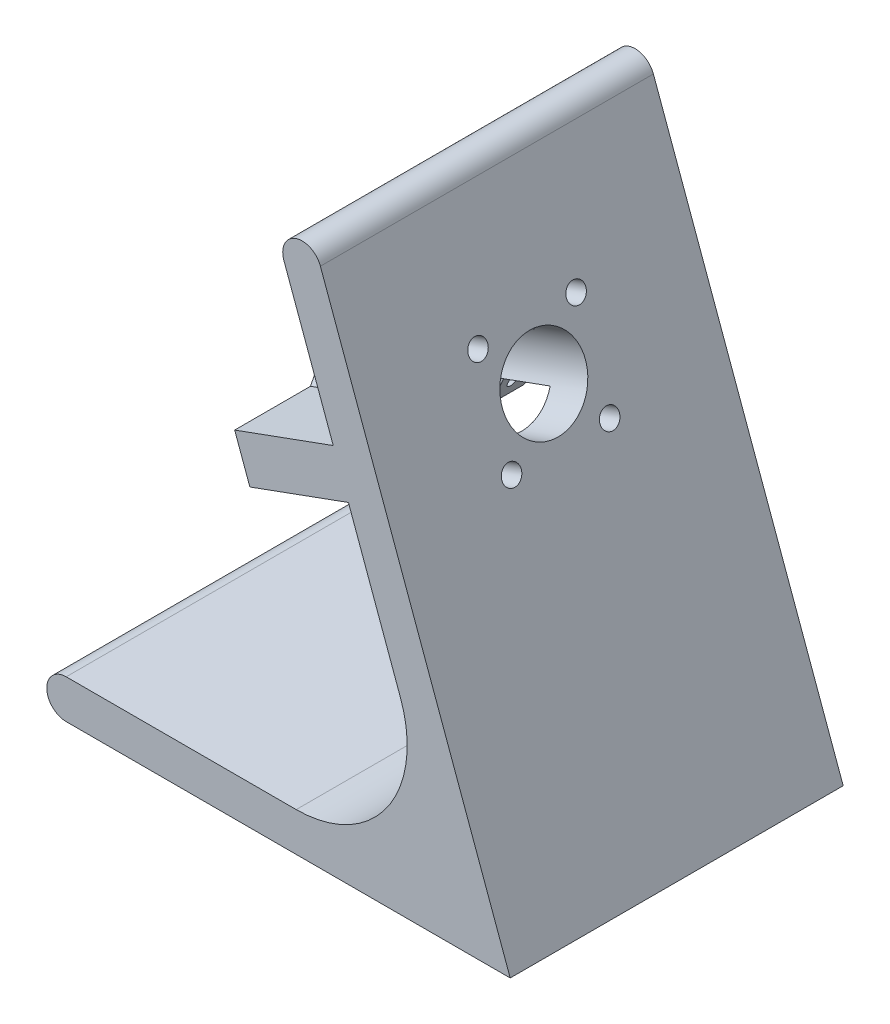
from build123d import *
from build123d.topology import SkipClean

# Parameters (mm, degrees)
BOSS_EXTRUDE1_DEPTH = 60
SKETCH2_R           = 7.5
CUT_EXTRUDE1_DEPTH  = 119.641534805
SKETCH3_R           = 1.75
CUT_EXTRUDE2_DEPTH  = 117.134798875
CHAMFER1_SIZE       = 2
CHAMFER1_SIZE2      = 1.154700538
BOSS_EXTRUDE2_DEPTH = 18.9
SKETCH5_W           = 5
SKETCH5_H           = 4
SKETCH5_R           = 1
BOSS_EXTRUDE3_DEPTH = 5
CHAMFER2_SIZE       = 5


with BuildPart() as part:
    # Sketch1 → Boss-Extrude1 (new body)
    with BuildSketch(Plane.XY):
        with BuildLine():
            Line((0, 0), (80, 0))
            Line((80, 0), (45.797985667, 93.969262079))
            ThreePointArc((45.797985667, 93.969262079), (41.311990993, 96.06111575), (39.220137322, 91.575121075))
            Line((39.220137322, 91.575121075), (60.233856234, 33.840402867))
            ThreePointArc((60.233856234, 33.840402867), (57.823044704, 15.528471273), (41.440003818, 7))
            Line((41.440003818, 7), (0, 7))
            ThreePointArc((0, 7), (-3.5, 3.5), (0, 0))
        make_face()
    extrude(amount=BOSS_EXTRUDE1_DEPTH)

    # Sketch2 → Cut-Extrude1 (cut, through all)
    with BuildSketch(Plane(origin=(70.641777725, 25.711504387, 0), x_dir=(0, 0, -1), z_dir=(0.9396926207859069, 0.3420201433256728, 0))):
        with Locations(Location((-30, 42.638388534, 0), (0, 0, 90))):
            Circle(SKETCH2_R)
    extrude(amount=-CUT_EXTRUDE1_DEPTH, mode=Mode.SUBTRACT)

    # Sketch3 → Cut-Extrude2 (cut, through all)
    with BuildSketch(Plane(origin=(64.063929379, 23.317363384, 0), x_dir=(0, 0, 1), z_dir=(-0.9396926207859071, -0.3420201433256726, 0))):
        with Locations(Location((21.161165235, 33.799553769, 0), (0, 0, 270))):
            Circle(SKETCH3_R)
        with Locations(Location((21.161165235, 51.477223299, 0), (0, 0, 270))):
            Circle(SKETCH3_R)
        with Locations(Location((38.838834765, 51.477223299, 0), (0, 0, 270))):
            Circle(SKETCH3_R)
        with Locations(Location((38.838834765, 33.799553769, 0), (0, 0, 270))):
            Circle(SKETCH3_R)
    extrude(amount=-CUT_EXTRUDE2_DEPTH, mode=Mode.SUBTRACT)

    # Chamfer1
    chamfer1_edges = [part.edges().sort_by_distance(p)[0] for p in [
        (45.859146838, 73.334592343, 21.161165235),
        (45.859146838, 73.334592343, 38.838834765),
        (51.905265904, 56.723016733, 38.838834765),
        (51.905265904, 56.723016733, 21.161165235),
    ]]
    chamfer1_side = [part.faces().sort_by_distance(p)[0] for p in [
        (39.513854258, 90.768140426, 30),
    ]]
    chamfer(chamfer1_edges, length=CHAMFER1_SIZE, length2=CHAMFER1_SIZE2, reference=chamfer1_side[0])

    # Sketch4 → Boss-Extrude2 (add)
    with SkipClean():  # the faces are left unmerged after this step: merging them gives an invalid solid
        with BuildSketch(Plane(origin=(64.063929379, 23.317363384, 0), x_dir=(0, 0, 1), z_dir=(-0.9396926207859071, -0.3420201433256726, 0))):
            with BuildLine():
                Line((36.34428877, 46.638388534), (60, 46.638388534))
                Line((60, 46.638388534), (60, 38.638388534))
                Line((60, 38.638388534), (36.34428877, 38.638388534))
                ThreePointArc((36.34428877, 38.638388534), (37.5, 42.638388534), (36.34428877, 46.638388534))
            make_face()
            with BuildLine():
                Line((0, 38.638388534), (23.65571123, 38.638388534))
                ThreePointArc((23.65571123, 38.638388534), (22.5, 42.638388534), (23.65571123, 46.638388534))
                Line((23.65571123, 46.638388534), (0, 46.638388534))
                Line((0, 46.638388534), (0, 38.638388534))
            make_face()
        extrude(amount=BOSS_EXTRUDE2_DEPTH)

    # Sketch5 → Boss-Extrude3 (add)
    # profile 1 of 4: a face of its own
    with SkipClean():  # the faces are left unmerged after this step: merging them gives an invalid solid
        with BuildSketch(Plane(origin=(46.303738846, 16.853182675, 0), x_dir=(0, 0, 1), z_dir=(-0.9396926207859069, -0.3420201433256728, 0))):
            with Locations((21.15571123, 48.638388534)):
                Rectangle(SKETCH5_W, SKETCH5_H)
            with Locations(Location((21, 48.138388534, 0), (0, 0, 270))):
                Circle(SKETCH5_R, mode=Mode.SUBTRACT)
        # profile 2 of 4: a face of its own
        with BuildSketch(Plane(origin=(46.303738846, 16.853182675, 0), x_dir=(0, 0, 1), z_dir=(-0.9396926207859069, -0.3420201433256728, 0))):
            with Locations((38.84428877, 48.638388534)):
                Rectangle(SKETCH5_W, SKETCH5_H)
            with Locations(Location((39, 48.138388534, 0), (0, 0, 90))):
                Circle(SKETCH5_R, mode=Mode.SUBTRACT)
        # profile 3 of 4: a face of its own
        with BuildSketch(Plane(origin=(46.303738846, 16.853182675, 0), x_dir=(0, 0, 1), z_dir=(-0.9396926207859069, -0.3420201433256728, 0))):
            with Locations((38.84428877, 36.638388534)):
                Rectangle(SKETCH5_W, SKETCH5_H)
            with Locations(Location((39, 37.138388534, 0), (0, 0, 270))):
                Circle(SKETCH5_R, mode=Mode.SUBTRACT)
        # profile 4 of 4: a face of its own
        with BuildSketch(Plane(origin=(46.303738846, 16.853182675, 0), x_dir=(0, 0, 1), z_dir=(-0.9396926207859069, -0.3420201433256728, 0))):
            with Locations((21.15571123, 36.638388534)):
                Rectangle(SKETCH5_W, SKETCH5_H)
            with Locations(Location((21, 37.138388534, 0), (0, 0, 90))):
                Circle(SKETCH5_R, mode=Mode.SUBTRACT)
        extrude(amount=-BOSS_EXTRUDE3_DEPTH)

    # Chamfer2
    # the kernel refuses this chamfer: 5 mm, written as the material it adds along each edge
    with BuildSketch(Plane(origin=(37.787094766, 54.871491976, 23.48587383), x_dir=(0.9299331952381907, 0.3677285036464934, 0), z_dir=(0, 0, 1))) as chamfer2_piece_1_section:
        Polygon((CHAMFER2_SIZE * 0.999621916911, -CHAMFER2_SIZE * 0.0274958766106), (-CHAMFER2_SIZE * 0.0274958766106, -CHAMFER2_SIZE * 0.999621916911), (0, 0), align=None)
    chamfer2_piece_1 = extrude(amount=17.85841494, mode=Mode.PRIVATE)
    chamfer2_piece_1 = chamfer2_piece_1 - Plane(origin=(38.02216053, 59.213760007, 30), x_dir=(0.18241074310702424, -0.5011693977524806, -0.8459051693633035), z_dir=(0.9396926207859071, 0.34202014332567265, 0)) * Cylinder(7.5, 56, mode=Mode.PRIVATE)
    chamfer2_piece_1 = split(chamfer2_piece_1, bisect_by=Plane(origin=(39.909169975, 54.029244166, 23.65571123), z_dir=(0, 0, -1)), keep=Keep.TOP, mode=Mode.PRIVATE)
    chamfer2_piece_1 = split(chamfer2_piece_1, bisect_by=Plane(origin=(40.758321676, 51.696219041, 23.570135946), z_dir=(-0.3420201433256728, 0.9396926207859069, 0)), keep=Keep.TOP, mode=Mode.PRIVATE)
    add(chamfer2_piece_1)
    with BuildSketch(Plane(origin=(37.787094766, 54.871491976, 36.34428877), x_dir=(0.9299331952381793, 0.3677285036465222, 0), z_dir=(0, 0, 1))) as chamfer2_piece_2_section:
        Polygon((CHAMFER2_SIZE * 0.999621916911, -CHAMFER2_SIZE * 0.0274958766106), (-CHAMFER2_SIZE * 0.0274958766106, -CHAMFER2_SIZE * 0.999621916911), (0, 0), align=None)
    chamfer2_piece_2 = extrude(amount=5, mode=Mode.PRIVATE)
    chamfer2_piece_2 = chamfer2_piece_2 - Plane(origin=(40.576659633, 60.143521644, 30), x_dir=(0.18241074310702424, -0.5011693977524806, -0.8459051693633035), z_dir=(0.9396926207859071, 0.34202014332567265, 0)) * Cylinder(7.5, 30, mode=Mode.PRIVATE)
    chamfer2_piece_2 = split(chamfer2_piece_2, bisect_by=Plane(origin=(43.312820779, 52.625980678, 40.510955437), z_dir=(-0.3420201433256728, 0.9396926207859069, 0)), keep=Keep.TOP, mode=Mode.PRIVATE)
    chamfer2_piece_2 = chamfer2_piece_2 - Plane(origin=(42.457770421, 54.97521223, 39), x_dir=(0.3420201433256728, -0.9396926207859069, 0), z_dir=(-0.9396926207859069, -0.3420201433256728, 0)) * Cylinder(1, 30, mode=Mode.PRIVATE)
    add(chamfer2_piece_2)
    with BuildSketch(Plane(origin=(33.088631662, 53.16139126, 41.34428877), x_dir=(-0.00940414365922947, 0.02583767235303998, 0.9996219169112959), z_dir=(0.9396926207859069, 0.3420201433256728, 0))) as chamfer2_piece_3_section:
        Polygon((CHAMFER2_SIZE * 0.999621916911, CHAMFER2_SIZE * 0.0274958766106), (-CHAMFER2_SIZE * 0.0274958766106, CHAMFER2_SIZE * 0.999621916911), (0, 0), align=None)
    chamfer2_piece_3 = extrude(amount=5, mode=Mode.PRIVATE)
    chamfer2_piece_3 = split(chamfer2_piece_3, bisect_by=Plane(origin=(36.805943787, 50.257671135, 43.072880832), z_dir=(-0.3420201433256728, 0.9396926207859069, 1.4210854715202e-15)), keep=Keep.TOP, mode=Mode.PRIVATE)
    add(chamfer2_piece_3)
    with BuildSketch(Plane(origin=(37.787094766, 54.871491976, 36.51412617), x_dir=(0.9299331952381907, 0.3677285036464934, 0), z_dir=(0, 0, -1))) as chamfer2_piece_4_section:
        Polygon((CHAMFER2_SIZE * 0.999621916911, CHAMFER2_SIZE * 0.0274958766106), (-CHAMFER2_SIZE * 0.0274958766106, CHAMFER2_SIZE * 0.999621916911), (0, 0), align=None)
    chamfer2_piece_4 = extrude(amount=17.85841494, mode=Mode.PRIVATE)
    chamfer2_piece_4 = chamfer2_piece_4 - Plane(origin=(38.022160531, 59.213760008, 30), x_dir=(0.18241074310702424, -0.5011693977524806, -0.8459051693633035), z_dir=(0.9396926207859071, 0.34202014332567265, 0)) * Cylinder(7.5, 56, mode=Mode.PRIVATE)
    chamfer2_piece_4 = split(chamfer2_piece_4, bisect_by=Plane(origin=(39.909169977, 54.029244164, 36.34428877), z_dir=(0, 0, 1)), keep=Keep.TOP, mode=Mode.PRIVATE)
    chamfer2_piece_4 = split(chamfer2_piece_4, bisect_by=Plane(origin=(40.758321677, 51.696219041, 36.429864054), z_dir=(-0.3420201433256728, 0.9396926207859069, 0)), keep=Keep.TOP, mode=Mode.PRIVATE)
    add(chamfer2_piece_4)
    with BuildSketch(Plane(origin=(37.787094766, 54.871491976, 23.65571123), x_dir=(0.9299331952381796, 0.36772850364652154, 0), z_dir=(0, 0, -1))) as chamfer2_piece_5_section:
        Polygon((CHAMFER2_SIZE * 0.999621916911, CHAMFER2_SIZE * 0.0274958766106), (-CHAMFER2_SIZE * 0.0274958766106, CHAMFER2_SIZE * 0.999621916911), (0, 0), align=None)
    chamfer2_piece_5 = extrude(amount=5, mode=Mode.PRIVATE)
    chamfer2_piece_5 = chamfer2_piece_5 - Plane(origin=(40.576659674, 60.143521659, 30), x_dir=(0.18241074310702424, -0.5011693977524806, -0.8459051693633035), z_dir=(0.9396926207859071, 0.34202014332567265, 0)) * Cylinder(7.5, 30, mode=Mode.PRIVATE)
    chamfer2_piece_5 = split(chamfer2_piece_5, bisect_by=Plane(origin=(43.31282082, 52.625980693, 19.489044563), z_dir=(-0.3420201433256728, 0.9396926207859069, 0)), keep=Keep.TOP, mode=Mode.PRIVATE)
    chamfer2_piece_5 = chamfer2_piece_5 - Plane(origin=(42.457770462, 54.975212245, 21), x_dir=(-0.3420201433256728, 0.9396926207859069, 0), z_dir=(-0.9396926207859069, -0.3420201433256728, 0)) * Cylinder(1, 30, mode=Mode.PRIVATE)
    add(chamfer2_piece_5)
    with BuildSketch(Plane(origin=(33.088631662, 53.16139126, 18.65571123), x_dir=(-0.009404143659228424, 0.02583767235303711, -0.9996219169112959), z_dir=(0.9396926207859069, 0.3420201433256728, 0))) as chamfer2_piece_6_section:
        Polygon((CHAMFER2_SIZE * 0.999621916911, -CHAMFER2_SIZE * 0.0274958766106), (-CHAMFER2_SIZE * 0.0274958766106, -CHAMFER2_SIZE * 0.999621916911), (0, 0), align=None)
    chamfer2_piece_6 = extrude(amount=5, mode=Mode.PRIVATE)
    chamfer2_piece_6 = split(chamfer2_piece_6, bisect_by=Plane(origin=(36.805943787, 50.257671135, 16.927119168), z_dir=(-0.3420201433256728, 0.9396926207859069, 0)), keep=Keep.TOP, mode=Mode.PRIVATE)
    add(chamfer2_piece_6)
    with BuildSketch(Plane(origin=(30.352470516, 60.678932226, 18.65571123), x_dir=(0.009404143659218054, -0.025837672353008618, -0.9996219169112968), z_dir=(0.9396926207859069, 0.3420201433256728, 0))) as chamfer2_piece_7_section:
        Polygon((CHAMFER2_SIZE * 0.999621916911, CHAMFER2_SIZE * 0.0274958766106), (-CHAMFER2_SIZE * 0.0274958766106, CHAMFER2_SIZE * 0.999621916911), (0, 0), align=None)
    chamfer2_piece_7 = extrude(amount=5, mode=Mode.PRIVATE)
    chamfer2_piece_7 = split(chamfer2_piece_7, bisect_by=Plane(origin=(31.333621494, 65.292753067, 16.927119168), z_dir=(0.3420201433256728, -0.9396926207859069, 0)), keep=Keep.TOP, mode=Mode.PRIVATE)
    add(chamfer2_piece_7)
    with BuildSketch(Plane(origin=(35.050933619, 62.389032943, 36.51412617), x_dir=(0.9487414825566265, 0.3160531589404771, 0), z_dir=(0, 0, -1))) as chamfer2_piece_8_section:
        Polygon((CHAMFER2_SIZE * 0.999621916911, -CHAMFER2_SIZE * 0.0274958766106), (-CHAMFER2_SIZE * 0.0274958766106, -CHAMFER2_SIZE * 0.999621916911), (0, 0), align=None)
    chamfer2_piece_8 = extrude(amount=17.85841494, mode=Mode.PRIVATE)
    chamfer2_piece_8 = chamfer2_piece_8 - Plane(origin=(38.02216053, 59.213760007, 30), x_dir=(0.18241074310702424, -0.5011693977524806, -0.8459051693633035), z_dir=(0.9396926207859071, 0.34202014332567265, 0)) * Cylinder(7.5, 56, mode=Mode.PRIVATE)
    chamfer2_piece_8 = split(chamfer2_piece_8, bisect_by=Plane(origin=(35.285999383, 66.731300974, 36.429864054), z_dir=(0.3420201433256728, -0.9396926207859069, 0)), keep=Keep.TOP, mode=Mode.PRIVATE)
    chamfer2_piece_8 = split(chamfer2_piece_8, bisect_by=Plane(origin=(36.135151084, 64.398275849, 36.34428877), z_dir=(0, 0, 1)), keep=Keep.TOP, mode=Mode.PRIVATE)
    add(chamfer2_piece_8)
    with BuildSketch(Plane(origin=(35.050933619, 62.389032943, 23.65571123), x_dir=(0.9487414825566265, 0.3160531589404771, 0), z_dir=(0, 0, -1))) as chamfer2_piece_9_section:
        Polygon((CHAMFER2_SIZE * 0.999621916911, -CHAMFER2_SIZE * 0.0274958766106), (-CHAMFER2_SIZE * 0.0274958766106, -CHAMFER2_SIZE * 0.999621916911), (0, 0), align=None)
    chamfer2_piece_9 = extrude(amount=5, mode=Mode.PRIVATE)
    chamfer2_piece_9 = chamfer2_piece_9 - Plane(origin=(40.576659674, 60.143521659, 30), x_dir=(0.18241074310702424, -0.5011693977524806, -0.8459051693633035), z_dir=(0.9396926207859071, 0.34202014332567265, 0)) * Cylinder(7.5, 30, mode=Mode.PRIVATE)
    chamfer2_piece_9 = split(chamfer2_piece_9, bisect_by=Plane(origin=(37.840498527, 67.661062625, 19.489044563), z_dir=(0.3420201433256728, -0.9396926207859069, 0)), keep=Keep.TOP, mode=Mode.PRIVATE)
    chamfer2_piece_9 = chamfer2_piece_9 - Plane(origin=(38.695548885, 65.311831073, 21), x_dir=(0.3420201433256728, -0.9396926207859069, 0), z_dir=(-0.9396926207859069, -0.3420201433256728, 0)) * Cylinder(1, 30, mode=Mode.PRIVATE)
    add(chamfer2_piece_9)
    with BuildSketch(Plane(origin=(35.050933619, 62.389032943, 41.34428877), x_dir=(0.9487414825566282, 0.3160531589404717, 0), z_dir=(0, 0, -1))) as chamfer2_piece_10_section:
        Polygon((CHAMFER2_SIZE * 0.999621916911, -CHAMFER2_SIZE * 0.0274958766106), (-CHAMFER2_SIZE * 0.0274958766106, -CHAMFER2_SIZE * 0.999621916911), (0, 0), align=None)
    chamfer2_piece_10 = extrude(amount=5, mode=Mode.PRIVATE)
    chamfer2_piece_10 = chamfer2_piece_10 - Plane(origin=(40.576659633, 60.143521644, 30), x_dir=(0.18241074310702424, -0.5011693977524806, -0.8459051693633035), z_dir=(0.9396926207859071, 0.34202014332567265, 0)) * Cylinder(7.5, 30, mode=Mode.PRIVATE)
    chamfer2_piece_10 = split(chamfer2_piece_10, bisect_by=Plane(origin=(37.840498486, 67.661062611, 37.177622104), z_dir=(0.3420201433256728, -0.9396926207859069, 0)), keep=Keep.TOP, mode=Mode.PRIVATE)
    chamfer2_piece_10 = chamfer2_piece_10 - Plane(origin=(38.695548844, 65.311831059, 39), x_dir=(-0.3420201433256728, 0.9396926207859069, 0), z_dir=(-0.9396926207859069, -0.3420201433256728, 0)) * Cylinder(1, 30, mode=Mode.PRIVATE)
    add(chamfer2_piece_10)
    with BuildSketch(Plane(origin=(35.050933619, 62.389032943, 41.34428877), x_dir=(0.9487414825566282, 0.3160531589404717, 0), z_dir=(0, 0, -1))) as chamfer2_piece_11_section:
        Polygon((CHAMFER2_SIZE * 0.999621916911, -CHAMFER2_SIZE * 0.0274958766106), (-CHAMFER2_SIZE * 0.0274958766106, -CHAMFER2_SIZE * 0.999621916911), (0, 0), align=None)
    chamfer2_piece_11 = extrude(amount=17.85841494, mode=Mode.PRIVATE)
    chamfer2_piece_11 = chamfer2_piece_11 - Plane(origin=(38.022160531, 59.213760008, 30), x_dir=(0.18241074310702424, -0.5011693977524806, -0.8459051693633035), z_dir=(0.9396926207859071, 0.34202014332567265, 0)) * Cylinder(7.5, 56, mode=Mode.PRIVATE)
    chamfer2_piece_11 = split(chamfer2_piece_11, bisect_by=Plane(origin=(35.285999384, 66.731300974, 23.570135946), z_dir=(0.3420201433256728, -0.9396926207859069, 0)), keep=Keep.TOP, mode=Mode.PRIVATE)
    chamfer2_piece_11 = split(chamfer2_piece_11, bisect_by=Plane(origin=(36.135151085, 64.398275851, 23.65571123), z_dir=(0, 0, -1)), keep=Keep.TOP, mode=Mode.PRIVATE)
    add(chamfer2_piece_11)
    with BuildSketch(Plane(origin=(30.352470516, 60.678932226, 41.34428877), x_dir=(0.009404143659219547, -0.025837672353012715, 0.9996219169112965), z_dir=(0.9396926207859069, 0.3420201433256728, 0))) as chamfer2_piece_12_section:
        Polygon((CHAMFER2_SIZE * 0.999621916911, -CHAMFER2_SIZE * 0.0274958766106), (-CHAMFER2_SIZE * 0.0274958766106, -CHAMFER2_SIZE * 0.999621916911), (0, 0), align=None)
    chamfer2_piece_12 = extrude(amount=5, mode=Mode.PRIVATE)
    chamfer2_piece_12 = split(chamfer2_piece_12, bisect_by=Plane(origin=(31.333621494, 65.292753067, 43.072880832), z_dir=(0.3420201433256728, -0.9396926207859069, 1.4210854715202e-15)), keep=Keep.TOP, mode=Mode.PRIVATE)
    add(chamfer2_piece_12)
    with BuildSketch(Plane(origin=(37.787094766, 54.871491976, 36.34428877), x_dir=(0.9299331952381793, 0.3677285036465222, 0), z_dir=(0, 0, 1))) as chamfer2_piece_13a_section:
        Polygon((CHAMFER2_SIZE * 0.999621916911, -CHAMFER2_SIZE * 0.0274958766106), (-CHAMFER2_SIZE * 0.0274958766106, -CHAMFER2_SIZE * 0.999621916911), (0, 0), align=None)
    chamfer2_piece_13a = extrude(amount=17.85841494, mode=Mode.PRIVATE)
    chamfer2_piece_13a = split(chamfer2_piece_13a, bisect_by=Plane(origin=(40.779520544, 51.703934798, 47.77349624), z_dir=(-0.3420201433256728, 0.9396926207859069, 0)), keep=Keep.TOP, mode=Mode.PRIVATE)
    chamfer2_piece_13a = split(chamfer2_piece_13a, bisect_by=Plane(origin=(39.923484947, 54.05587327, 41.34428877), z_dir=(0, 0, 1)), keep=Keep.TOP, mode=Mode.PRIVATE)
    with BuildSketch(Plane(origin=(33.088631662, 53.16139126, 41.34428877), x_dir=(-0.00940414365922947, 0.02583767235303998, 0.9996219169112959), z_dir=(0.9396926207859069, 0.3420201433256728, 0))) as chamfer2_piece_13b_section:
        Polygon((CHAMFER2_SIZE * 0.999621916911, CHAMFER2_SIZE * 0.0274958766106), (-CHAMFER2_SIZE * 0.0274958766106, CHAMFER2_SIZE * 0.999621916911), (0, 0), align=None)
    chamfer2_piece_13b = extrude(amount=17.85841494, mode=Mode.PRIVATE)
    chamfer2_piece_13b = split(chamfer2_piece_13b, bisect_by=Plane(origin=(38.299139743, 53.464659965, 43.072880832), z_dir=(0.9396926207859069, 0.3420201433256728, 0)), keep=Keep.TOP, mode=Mode.PRIVATE)
    chamfer2_piece_13b = split(chamfer2_piece_13b, bisect_by=Plane(origin=(45.196654156, 53.311639954, 43.072880832), z_dir=(-0.3420201433256728, 0.9396926207859069, 1.4210854715202e-15)), keep=Keep.TOP, mode=Mode.PRIVATE)
    chamfer2_piece_13 = chamfer2_piece_13a & chamfer2_piece_13b
    add(chamfer2_piece_13)
    with BuildSketch(Plane(origin=(37.787094766, 54.871491976, 23.65571123), x_dir=(0.9299331952381796, 0.36772850364652154, 0), z_dir=(0, 0, -1))) as chamfer2_piece_14a_section:
        Polygon((CHAMFER2_SIZE * 0.999621916911, CHAMFER2_SIZE * 0.0274958766106), (-CHAMFER2_SIZE * 0.0274958766106, CHAMFER2_SIZE * 0.999621916911), (0, 0), align=None)
    chamfer2_piece_14a = extrude(amount=17.85841494, mode=Mode.PRIVATE)
    chamfer2_piece_14a = split(chamfer2_piece_14a, bisect_by=Plane(origin=(39.923484947, 54.05587327, 18.65571123), z_dir=(0, 0, -1)), keep=Keep.TOP, mode=Mode.PRIVATE)
    chamfer2_piece_14a = split(chamfer2_piece_14a, bisect_by=Plane(origin=(40.779520544, 51.703934798, 12.22650376), z_dir=(-0.3420201433256728, 0.9396926207859069, 0)), keep=Keep.TOP, mode=Mode.PRIVATE)
    with BuildSketch(Plane(origin=(33.088631662, 53.16139126, 18.65571123), x_dir=(-0.009404143659228424, 0.02583767235303711, -0.9996219169112959), z_dir=(0.9396926207859069, 0.3420201433256728, 0))) as chamfer2_piece_14b_section:
        Polygon((CHAMFER2_SIZE * 0.999621916911, -CHAMFER2_SIZE * 0.0274958766106), (-CHAMFER2_SIZE * 0.0274958766106, -CHAMFER2_SIZE * 0.999621916911), (0, 0), align=None)
    chamfer2_piece_14b = extrude(amount=17.85841494, mode=Mode.PRIVATE)
    chamfer2_piece_14b = split(chamfer2_piece_14b, bisect_by=Plane(origin=(38.299139743, 53.464659965, 16.927119168), z_dir=(0.9396926207859069, 0.3420201433256728, 0)), keep=Keep.TOP, mode=Mode.PRIVATE)
    chamfer2_piece_14b = split(chamfer2_piece_14b, bisect_by=Plane(origin=(45.196654156, 53.311639954, 16.927119168), z_dir=(-0.3420201433256728, 0.9396926207859069, 0)), keep=Keep.TOP, mode=Mode.PRIVATE)
    chamfer2_piece_14 = chamfer2_piece_14a & chamfer2_piece_14b
    add(chamfer2_piece_14)
    with BuildSketch(Plane(origin=(30.352470516, 60.678932226, 18.65571123), x_dir=(0.009404143659218054, -0.025837672353008618, -0.9996219169112968), z_dir=(0.9396926207859069, 0.3420201433256728, 0))) as chamfer2_piece_15a_section:
        Polygon((CHAMFER2_SIZE * 0.999621916911, CHAMFER2_SIZE * 0.0274958766106), (-CHAMFER2_SIZE * 0.0274958766106, CHAMFER2_SIZE * 0.999621916911), (0, 0), align=None)
    chamfer2_piece_15a = extrude(amount=17.85841494, mode=Mode.PRIVATE)
    chamfer2_piece_15a = split(chamfer2_piece_15a, bisect_by=Plane(origin=(39.724331863, 68.346721886, 16.927119168), z_dir=(0.3420201433256728, -0.9396926207859069, 0)), keep=Keep.TOP, mode=Mode.PRIVATE)
    chamfer2_piece_15a = split(chamfer2_piece_15a, bisect_by=Plane(origin=(34.538888643, 63.795864954, 16.927119168), z_dir=(0.9396926207859069, 0.3420201433256728, 0)), keep=Keep.TOP, mode=Mode.PRIVATE)
    with BuildSketch(Plane(origin=(35.050933619, 62.389032943, 23.65571123), x_dir=(0.9487414825566265, 0.3160531589404771, 0), z_dir=(0, 0, -1))) as chamfer2_piece_15b_section:
        Polygon((CHAMFER2_SIZE * 0.999621916911, -CHAMFER2_SIZE * 0.0274958766106), (-CHAMFER2_SIZE * 0.0274958766106, -CHAMFER2_SIZE * 0.999621916911), (0, 0), align=None)
    chamfer2_piece_15b = extrude(amount=17.85841494, mode=Mode.PRIVATE)
    chamfer2_piece_15b = split(chamfer2_piece_15b, bisect_by=Plane(origin=(36.163233847, 64.387078259, 18.65571123), z_dir=(0, 0, -1)), keep=Keep.TOP, mode=Mode.PRIVATE)
    chamfer2_piece_15b = split(chamfer2_piece_15b, bisect_by=Plane(origin=(35.307198251, 66.73901673, 12.22650376), z_dir=(0.3420201433256728, -0.9396926207859069, 0)), keep=Keep.TOP, mode=Mode.PRIVATE)
    chamfer2_piece_15 = chamfer2_piece_15a & chamfer2_piece_15b
    add(chamfer2_piece_15)
    with BuildSketch(Plane(origin=(30.352470516, 60.678932226, 41.34428877), x_dir=(0.009404143659219547, -0.025837672353012715, 0.9996219169112965), z_dir=(0.9396926207859069, 0.3420201433256728, 0))) as chamfer2_piece_16a_section:
        Polygon((CHAMFER2_SIZE * 0.999621916911, -CHAMFER2_SIZE * 0.0274958766106), (-CHAMFER2_SIZE * 0.0274958766106, -CHAMFER2_SIZE * 0.999621916911), (0, 0), align=None)
    chamfer2_piece_16a = extrude(amount=17.85841494, mode=Mode.PRIVATE)
    chamfer2_piece_16a = split(chamfer2_piece_16a, bisect_by=Plane(origin=(39.724331863, 68.346721886, 43.072880832), z_dir=(0.3420201433256728, -0.9396926207859069, 1.4210854715202e-15)), keep=Keep.TOP, mode=Mode.PRIVATE)
    chamfer2_piece_16a = split(chamfer2_piece_16a, bisect_by=Plane(origin=(34.538888643, 63.795864954, 43.072880832), z_dir=(0.9396926207859069, 0.3420201433256728, 0)), keep=Keep.TOP, mode=Mode.PRIVATE)
    with BuildSketch(Plane(origin=(35.050933619, 62.389032943, 54.20270371), x_dir=(0.9487414825566265, 0.3160531589404771, 0), z_dir=(0, 0, -1))) as chamfer2_piece_16b_section:
        Polygon((CHAMFER2_SIZE * 0.999621916911, -CHAMFER2_SIZE * 0.0274958766106), (-CHAMFER2_SIZE * 0.0274958766106, -CHAMFER2_SIZE * 0.999621916911), (0, 0), align=None)
    chamfer2_piece_16b = extrude(amount=17.85841494, mode=Mode.PRIVATE)
    chamfer2_piece_16b = split(chamfer2_piece_16b, bisect_by=Plane(origin=(35.307198251, 66.73901673, 47.77349624), z_dir=(0.3420201433256728, -0.9396926207859069, 0)), keep=Keep.TOP, mode=Mode.PRIVATE)
    chamfer2_piece_16b = split(chamfer2_piece_16b, bisect_by=Plane(origin=(36.163233847, 64.387078259, 41.34428877), z_dir=(0, 0, 1)), keep=Keep.TOP, mode=Mode.PRIVATE)
    chamfer2_piece_16 = chamfer2_piece_16a & chamfer2_piece_16b
    add(chamfer2_piece_16)


solid = part.part
